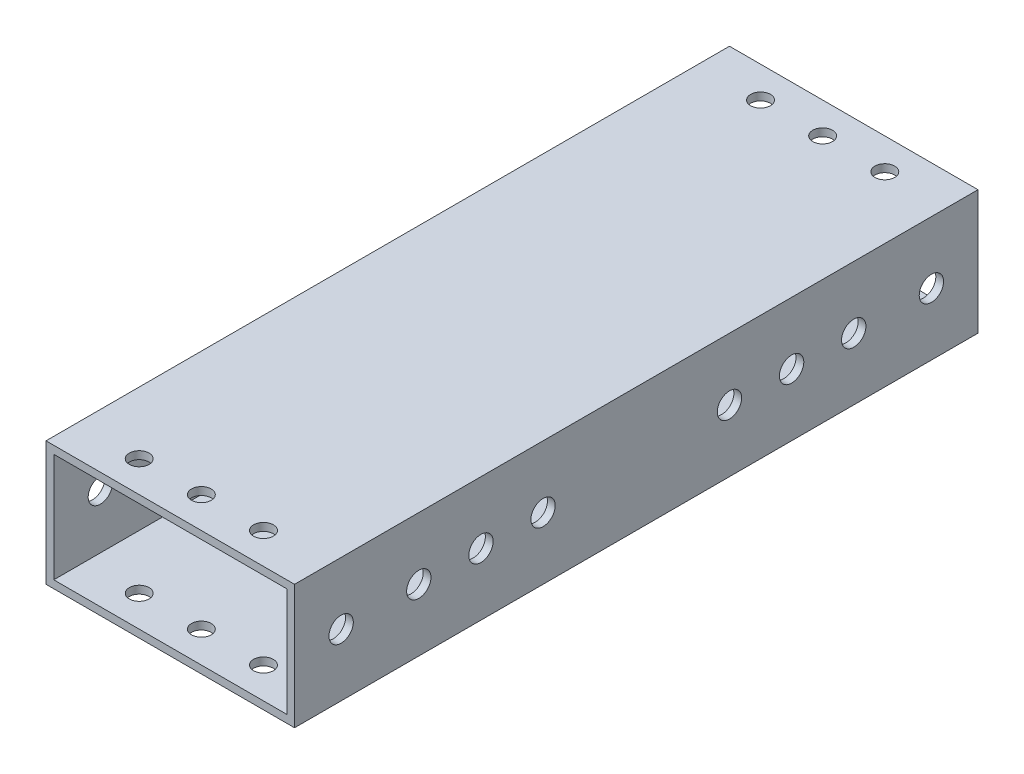
from build123d import *

# Parameters (mm, degrees)
SKETCH1_W           = 50.8
SKETCH1_H           = 25.4
SKETCH1_W_2         = 47.625
SKETCH1_H_2         = 22.225
BOSS_EXTRUDE1_DEPTH = 69.85
SKETCH2_R           = 2.0193
CUT_EXTRUDE1_DEPTH  = 79.545162168
SKETCH3_R           = 2.4892
CUT_EXTRUDE2_DEPTH  = 88.298066989


with BuildPart() as part:
    # Sketch1 → Boss-Extrude1 (new, symmetric)
    with BuildSketch(Plane.XY):
        Rectangle(SKETCH1_W, SKETCH1_H)
        Rectangle(SKETCH1_W_2, SKETCH1_H_2, mode=Mode.SUBTRACT)
    extrude(amount=BOSS_EXTRUDE1_DEPTH, both=True)

    # Sketch2 → Cut-Extrude1 (cut, through all)
    with BuildSketch(Plane(origin=(0, 12.7, 0), x_dir=(1, 0, 0), z_dir=(0, 1, 0))):
        with Locations((-12.7, 63.5)):
            Circle(SKETCH2_R)
        with Locations((0, 63.5)):
            Circle(SKETCH2_R)
        with Locations((12.7, 63.5)):
            Circle(SKETCH2_R)
        with Locations((12.7, -63.5)):
            Circle(SKETCH2_R)
        with Locations((0, -63.5)):
            Circle(SKETCH2_R)
        with Locations((-12.7, -63.5)):
            Circle(SKETCH2_R)
    extrude(amount=-CUT_EXTRUDE1_DEPTH, mode=Mode.SUBTRACT)

    # Sketch3 → Cut-Extrude2 (cut, through all)
    with BuildSketch(Plane(origin=(25.4, 0, 0), x_dir=(0, 0, -1), z_dir=(1, 0, 0))):
        with Locations((-60.325, 0)):
            Circle(SKETCH3_R)
        with Locations((60.325, 0)):
            Circle(SKETCH3_R)
        with Locations((-44.45, 0)):
            Circle(SKETCH3_R)
        with Locations((-31.75, 0)):
            Circle(SKETCH3_R)
        with Locations((31.75, 0)):
            Circle(SKETCH3_R)
        with Locations((44.45, 0)):
            Circle(SKETCH3_R)
        with Locations((-19.05, 0)):
            Circle(SKETCH3_R)
        with Locations((19.05, 0)):
            Circle(SKETCH3_R)
    extrude(amount=-CUT_EXTRUDE2_DEPTH, mode=Mode.SUBTRACT)


solid = part.part
